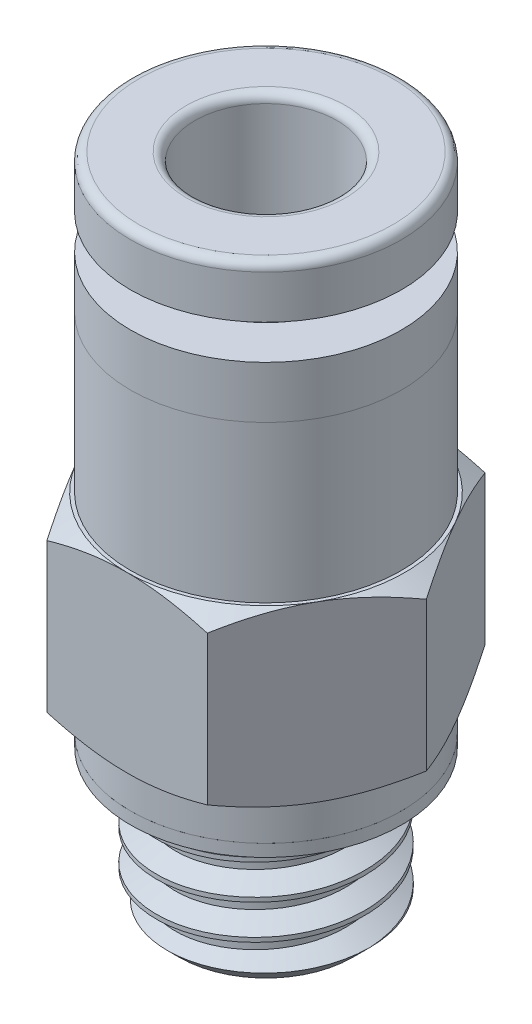
from build123d import *

# Parameters (mm, degrees)
BOSS_EXTRUDE1_DEPTH     = 2.5
SKETCH2_OUTSIDE_W       = 31.2
SKETCH2_OUTSIDE_H       = 29.962
SKETCH2_OUTSIDE_R       = 4
CUT_EXTRUDE1_DEPTH      = 5
CUT_EXTRUDE1_DRAFT      = -60
MIRROR1_COPY_1_SKETCH_W = 31.2
MIRROR1_COPY_1_SKETCH_H = 29.962
MIRROR1_COPY_1_SKETCH_R = 4
MIRROR1_COPY_1_DEPTH    = 5
MIRROR1_COPY_1_DRAFT    = -60
SKETCH3_R               = 3.9
BOSS_EXTRUDE2_DEPTH     = 4.5
SKETCH4_R               = 3.9
BOSS_EXTRUDE3_DEPTH     = 4
SKETCH6_OUTSIDE_W       = 14.88
SKETCH6_OUTSIDE_H       = 13.642
SKETCH6_OUTSIDE_R       = 2.5
CUT_EXTRUDE2_DEPTH      = 0.5
SKETCH7_R               = 2.05
CUT_EXTRUDE3_DEPTH      = 12
BOSS_EXTRUDE4_START     = 1
SKETCH8_R               = 3.9
BOSS_EXTRUDE4_DEPTH     = 1
SKETCH9_R               = 3
BOSS_EXTRUDE5_DEPTH     = 4.35
SKETCH10_R              = 3.9
SKETCH10_R_2            = 3
BOSS_EXTRUDE6_DEPTH     = 0.35
CHAMFER1_SIZE           = 0.5
THREAD1_PITCH           = 1
SKETCH14_R              = 1.2
CUT_EXTRUDE4_DEPTH      = 20.815545244
CHAMFER2_SIZE           = 0.1
FILLET1_R               = 0.25


with BuildPart() as part:
    # Sketch1 → Boss-Extrude1 (new, symmetric)
    with BuildSketch(Plane(origin=(0, 0, 0), x_dir=(1, 0, 0), z_dir=(0, 1, 0))):
        Polygon((2.309401077, -4), (4.618802154, 0), (2.309401077, 4), (-2.309401077, 4), (-4.618802154, 0), (-2.309401077, -4), align=None)
    extrude(amount=BOSS_EXTRUDE1_DEPTH, both=True)


with BuildPart() as cut_extrude1_tool:
    # Sketch2 outside → Cut-Extrude1 (with draft: the straight prism first)
    with BuildSketch(Plane(origin=(0, 2.5, 0), x_dir=(1, 0, 0), z_dir=(0, 1, 0))):
        Rectangle(SKETCH2_OUTSIDE_W, SKETCH2_OUTSIDE_H)
        Circle(SKETCH2_OUTSIDE_R, mode=Mode.SUBTRACT)
    extrude(amount=-CUT_EXTRUDE1_DEPTH)
    # Cut-Extrude1: the draft: its side faces are tilted about the plane it starts from
    cut_extrude1_sides = [cut_extrude1_tool.faces().sort_by_distance(p)[0] for p in [
        (0, 0, 14.981),
        (15.6, 0, 0),
        (0, 0, -14.981),
        (-15.6, 0, 0),
        (-4, 0, 0),
    ]]
    draft(cut_extrude1_sides, Plane(origin=(0, 2.5, 0), x_dir=(1, 0, 0), z_dir=(0, 1, 0)), CUT_EXTRUDE1_DRAFT)


with BuildPart() as part_1:
    add(part.part)

    # Cut-Extrude1: cut by cut_extrude1_tool
    add(cut_extrude1_tool.part, mode=Mode.SUBTRACT)


with BuildPart() as mirror1_copy_1_tool:
    # Mirror1 copy 1 sketch → Mirror1 copy 1 (with draft: the straight prism first)
    with BuildSketch(Plane.XZ.offset(2.5)):
        Rectangle(MIRROR1_COPY_1_SKETCH_W, MIRROR1_COPY_1_SKETCH_H)
        Circle(MIRROR1_COPY_1_SKETCH_R, mode=Mode.SUBTRACT)
    extrude(amount=-MIRROR1_COPY_1_DEPTH)
    # Mirror1 copy 1: the draft: its side faces are tilted about the plane it starts from
    mirror1_copy_1_sides = [mirror1_copy_1_tool.faces().sort_by_distance(p)[0] for p in [
        (0, 0, 14.981),
        (15.6, 0, 0),
        (0, 0, -14.981),
        (-15.6, 0, 0),
        (-4, 0, 0),
    ]]
    draft(mirror1_copy_1_sides, Plane.XZ.offset(2.5), MIRROR1_COPY_1_DRAFT)


with BuildPart() as part_2:
    add(part_1.part)

    # Mirror1 copy 1: cut by mirror1_copy_1_tool
    add(mirror1_copy_1_tool.part, mode=Mode.SUBTRACT)

    # Sketch3 → Boss-Extrude2 (add)
    with BuildSketch(Plane(origin=(0, 2.5, 0), x_dir=(1, 0, 0), z_dir=(0, 1, 0))):
        with Locations(Location((0, 0, 0), (0, 0, 270))):
            Circle(SKETCH3_R)
    extrude(amount=BOSS_EXTRUDE2_DEPTH)


with BuildPart() as body_2:
    # Sketch4 → Boss-Extrude3 (new body)
    with BuildSketch(Plane(origin=(0, 7, 0), x_dir=(1, 0, 0), z_dir=(0, 1, 0))):
        with Locations(Location((0, 0, 0), (0, 0, 270))):
            Circle(SKETCH4_R)
    extrude(amount=BOSS_EXTRUDE3_DEPTH)

    # Sketch6 outside → Cut-Extrude2 (cut, symmetric)
    with BuildSketch(Plane(origin=(0, 9, 0), x_dir=(1, 0, 0), z_dir=(0, 1, 0))):
        Rectangle(SKETCH6_OUTSIDE_W, SKETCH6_OUTSIDE_H)
        with Locations(Location((0, 0, 0), (0, 0, 270))):
            Circle(SKETCH6_OUTSIDE_R, mode=Mode.SUBTRACT)
    extrude(amount=CUT_EXTRUDE2_DEPTH, both=True, mode=Mode.SUBTRACT)


with BuildPart() as cut_extrude3_tool:
    # Sketch7 → Cut-Extrude3 (new body)
    with BuildSketch(Plane(origin=(0, 11, 0), x_dir=(1, 0, 0), z_dir=(0, 1, 0))):
        with Locations(Location((0, 0, 0), (0, 0, 270))):
            Circle(SKETCH7_R)
    extrude(amount=-CUT_EXTRUDE3_DEPTH)


with BuildPart() as part_3:
    add(part_2.part)

    # Cut-Extrude3: cut by cut_extrude3_tool
    add(cut_extrude3_tool.part, mode=Mode.SUBTRACT)

    # Sketch8 → Boss-Extrude4 (add)
    with BuildSketch(Plane.XZ.offset(2.5).offset(BOSS_EXTRUDE4_START)):
        with Locations(Location((0, 0, 0), (0, 0, 90))):
            Circle(SKETCH8_R)
    extrude(amount=-BOSS_EXTRUDE4_DEPTH)

    # Sketch9 → Boss-Extrude5 (add)
    with BuildSketch(Plane.XZ.offset(3.5)):
        with Locations(Location((0, 0, 0), (0, 0, 270))):
            Circle(SKETCH9_R)
    extrude(amount=BOSS_EXTRUDE5_DEPTH)

    # Chamfer1
    chamfer1_edges = [part_3.edges().sort_by_distance(p)[0] for p in [
        (0, -7.85, 3),
    ]]
    chamfer(chamfer1_edges, length=CHAMFER1_SIZE)

    # Thread1: the profile of Thread Profile1 profile screwed along a right-hand helix of 4.5 turns, 8 arcs to a turn; built about Z, then put on its axis
    thread1_z = Axis((0, 0, 0), (0, 0, 1))
    thread1_corners = [(3.0003, 0, -0.000173205), (3.0003, 0, 0.875173202), (2.458734125, 0, 0.562499999), (2.458734125, 0, 0.312499999)]
    with BuildLine(mode=Mode.PRIVATE) as thread1_profile:
        Line(thread1_corners[0], thread1_corners[1])
        Line(thread1_corners[1], thread1_corners[2])
        Line(thread1_corners[2], thread1_corners[3])
        Line(thread1_corners[3], thread1_corners[0])
    thread1_cap = Face(thread1_profile.wire())
    thread1_turn_angles = [0, 22.5, 45, 67.5, 90, 112.5, 135, 157.5, 180, 202.5, 225, 247.5, 270, 292.5, 315, 337.5, 360]
    thread1_turn_weights = [1, 0.9238795325112867, 1, 0.9238795325112867, 1, 0.9238795325112867, 1, 0.9238795325112867, 1, 0.9238795325112867, 1, 0.9238795325112867, 1, 0.9238795325112867, 1, 0.9238795325112867, 1]
    thread1_turn_rails = [Edge.make_bspline([Vector(p[0], p[1], 0).rotate(thread1_z, thread1_turn_angles[k]) / thread1_turn_weights[k] + Vector(0, 0, p[2] + THREAD1_PITCH * thread1_turn_angles[k] / 360) for k in range(17)], [0, 0, 0, 1, 1, 2, 2, 3, 3, 4, 4, 5, 5, 6, 6, 7, 7, 8, 8, 8], 2, thread1_turn_weights) for p in thread1_corners]
    thread1_turn_sides = [Face.make_surface_from_curves(thread1_turn_rails[p[0]], thread1_turn_rails[p[1]]) for p in [(0, 1), (1, 2), (2, 3), (3, 0)]]
    thread1_last_angles = [1440, 1462.5, 1485, 1507.5, 1530, 1552.5, 1575, 1597.5, 1620]
    thread1_last_weights = [1, 0.9238795325112867, 1, 0.9238795325112867, 1, 0.9238795325112867, 1, 0.9238795325112867, 1]
    thread1_last_rails = [Edge.make_bspline([Vector(p[0], p[1], 0).rotate(thread1_z, thread1_last_angles[k]) / thread1_last_weights[k] + Vector(0, 0, p[2] + THREAD1_PITCH * thread1_last_angles[k] / 360) for k in range(9)], [0, 0, 0, 1, 1, 2, 2, 3, 3, 4, 4, 4], 2, thread1_last_weights) for p in thread1_corners]
    thread1_last_sides = [Face.make_surface_from_curves(thread1_last_rails[p[0]], thread1_last_rails[p[1]]) for p in [(0, 1), (1, 2), (2, 3), (3, 0)]]
    thread1 = Plane(origin=(0, -8.35, 0), x_dir=(1, 0, 0), z_dir=(0, 1, 0)) * Solid(Shell([*[p.moved(Location((0, 0, THREAD1_PITCH * i))) for i in range(4) for p in thread1_turn_sides], *thread1_last_sides, thread1_cap, thread1_cap.rotate(thread1_z, 1620).moved(Location((0, 0, THREAD1_PITCH * 1620 / 360)))]))
    add(thread1, mode=Mode.SUBTRACT)

    # Sketch14 → Cut-Extrude4 (cut, through all)
    with BuildSketch(Plane.XZ.offset(7.85)):
        with Locations(Location((0, 0, 0), (0, 0, 270))):
            Circle(SKETCH14_R)
    extrude(amount=-CUT_EXTRUDE4_DEPTH, mode=Mode.SUBTRACT)

    # Chamfer2
    chamfer2_edges = [part_3.edges().sort_by_distance(p)[0] for p in [
        (0, -7.85, 1.2),
    ]]
    chamfer(chamfer2_edges, length=CHAMFER2_SIZE)


with BuildPart() as body_2_1:
    add(body_2.part)

    # Cut-Extrude3: cut by cut_extrude3_tool
    add(cut_extrude3_tool.part, mode=Mode.SUBTRACT)

    # Fillet1
    fillet1_edges = [body_2_1.edges().sort_by_distance(p)[0] for p in [
        (0, 11, -2.05),
        (0, 11, -3.9),
    ]]
    fillet(fillet1_edges, radius=FILLET1_R)


with BuildPart() as body_3:
    # Sketch10 → Boss-Extrude6 (new body)
    with BuildSketch(Plane.XZ.offset(3.5)):
        with Locations(Location((0, 0, 0), (0, 0, 270))):
            Circle(SKETCH10_R)
        with Locations(Location((0, 0, 0), (0, 0, 270))):
            Circle(SKETCH10_R_2, mode=Mode.SUBTRACT)
    extrude(amount=BOSS_EXTRUDE6_DEPTH)


solid = Compound([part_3.part, body_2_1.part, body_3.part])
